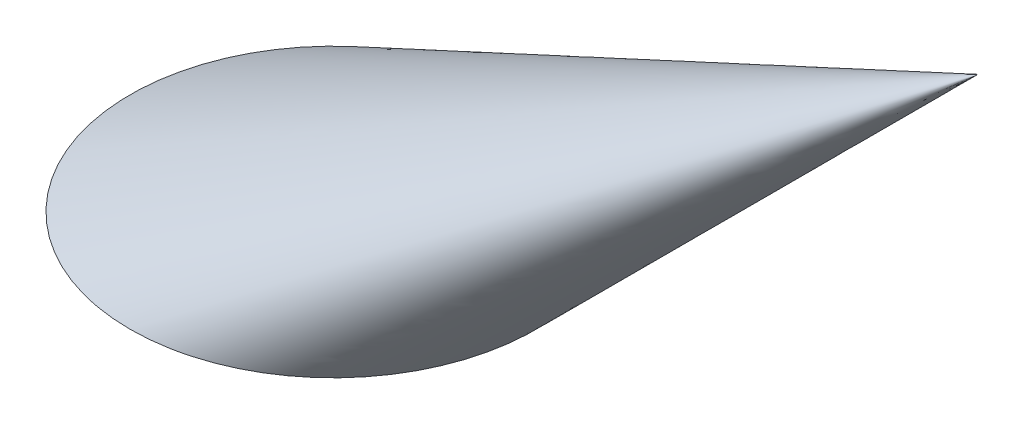
from build123d import *

# Parameters (mm, degrees)
SKETCH_1_R = 460


with BuildPart() as part:
    # 草图1 → 放样1 section 0
    with BuildSketch(Plane(origin=(0, 0, 0), x_dir=(1, 0, 0), z_dir=(0, 1, 0)), mode=Mode.PRIVATE) as loft_1_s0:
        Circle(SKETCH_1_R)
    loft([loft_1_s0.sketch, Vertex(1460, 1000, 0)])


solid = part.part
